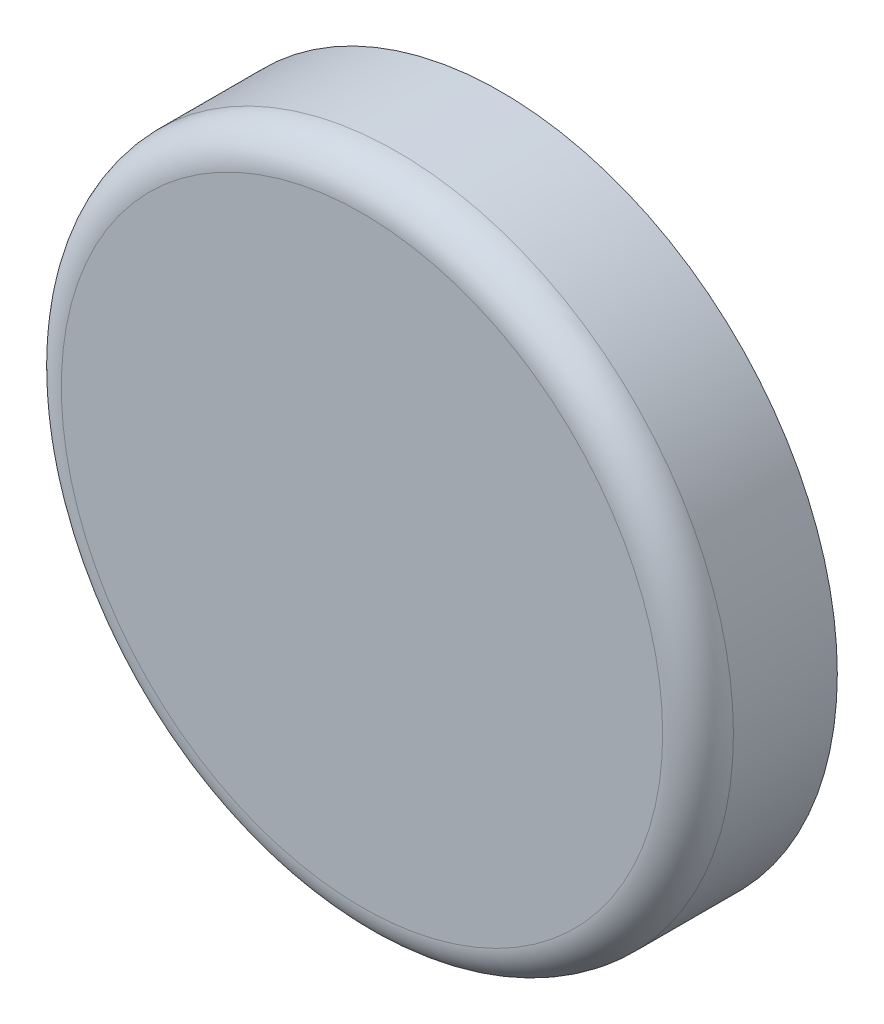
from build123d import *

# Parameters (mm, degrees)
SKETCH1_R           = 12.065
BOSS_EXTRUDE1_DEPTH = 5
FILLET1_R           = 1.27
SKETCH2_W           = 1.016
SKETCH2_H           = 2.568
SKETCH2_W_2         = 2.568
SKETCH2_H_2         = 1.016
BOSS_EXTRUDE2_DEPTH = 1.524


with BuildPart() as part:
    # Sketch1 → Boss-Extrude1 (new body)
    with BuildSketch(Plane.XY):
        Circle(SKETCH1_R)
    extrude(amount=BOSS_EXTRUDE1_DEPTH)

    # Fillet1
    fillet1_edges = [part.edges().sort_by_distance(p)[0] for p in [
        (-12.065, 0, 5),
    ]]
    fillet(fillet1_edges, radius=FILLET1_R)

    # Sketch2 → Boss-Extrude2 (add)
    with BuildSketch(Plane(origin=(0, 0, 0), x_dir=(-1, 0, 0), z_dir=(0, 0, -1))):
        with Locations((2.808, 0)):
            Rectangle(SKETCH2_W, SKETCH2_H)
        with Locations((0, 2.808)):
            Rectangle(SKETCH2_W_2, SKETCH2_H_2)
        with Locations((0, -2.808)):
            Rectangle(SKETCH2_W_2, SKETCH2_H_2)
        with Locations((-2.808, 0)):
            Rectangle(SKETCH2_W, SKETCH2_H)
    extrude(amount=BOSS_EXTRUDE2_DEPTH)


solid = part.part
